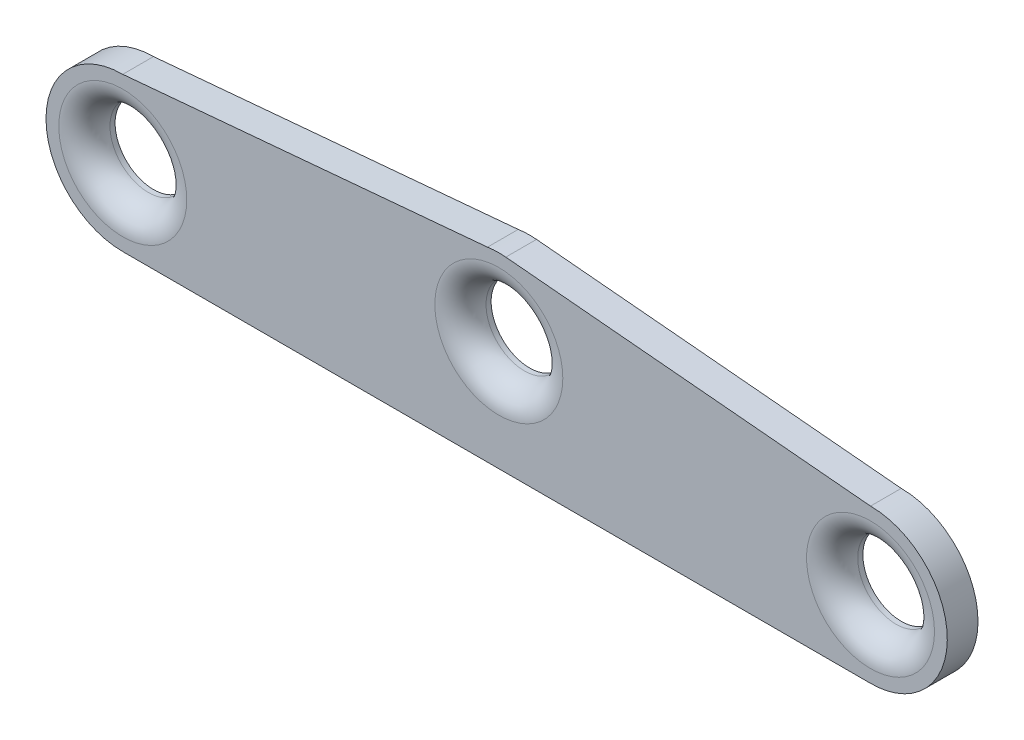
from build123d import *

# Parameters (mm, degrees)
SKETCH_1_R        = 3
SKETCH_1_R_2      = 1.5
EXTRUDE_1_DEPTH   = 1.2
EXTRUDE_1_2_DEPTH = 1.2
EXTRUDE_1_3_DEPTH = 1.2
EXTRUDE_START     = -1.2
EXTRUDE_6_DEPTH   = 1.2
FILLET_1_R        = 1


# Read off the part's stored shape, not the designer's step: Бобышка-Вытянуть6
with BuildPart() as part:
    # Эскиз1 → Бобышка-Вытянуть1 (new body)
    with BuildSketch(Plane.XY):
        with Locations((-14.609483562, -0.654127434)):
            Circle(SKETCH_1_R)
        with Locations((-14.609483562, -0.654127434)):
            Circle(SKETCH_1_R_2, mode=Mode.SUBTRACT)
    extrude(amount=EXTRUDE_1_DEPTH)



with BuildPart() as body_2:
    # Эскиз1 → Extrude 1 2 (new body)
    with BuildSketch(Plane.XY):
        with Locations((0.085103447, 0.656172203)):
            Circle(SKETCH_1_R)
        with Locations((0.085103447, 0.656172203)):
            Circle(SKETCH_1_R_2, mode=Mode.SUBTRACT)
    extrude(amount=EXTRUDE_1_2_DEPTH)


with BuildPart() as body_3:
    # Эскиз1 → Extrude 1 3 (new body)
    with BuildSketch(Plane.XY):
        with Locations((14.609483562, -0.656172203)):
            Circle(SKETCH_1_R)
        with Locations((14.609483562, -0.656172203)):
            Circle(SKETCH_1_R_2, mode=Mode.SUBTRACT)
    extrude(amount=EXTRUDE_1_3_DEPTH)


with BuildPart() as part_1:
    add(part.part)

    add(body_2.part)  # Бобышка-Вытянуть6 merges body 2

    add(body_3.part)  # Бобышка-Вытянуть6 merges body 3
    # Бобышка-Вытянуть6 outline → Бобышка-Вытянуть6 (add)
    with BuildSketch(Plane.XY.offset(1.2).offset(EXTRUDE_START)):
        with BuildLine():
            Line((-0.357791462, 3.62329945), (-14.609483562, 2.345872566))
            ThreePointArc((-14.609483562, 2.345872566), (-11.609512533, -0.640943153), (-14.583115254, -3.65401155))
            Line((-14.583115254, -3.65401155), (14.52155751, -3.654883428))
            ThreePointArc((14.52155751, -3.654883428), (11.609805773, -0.612204455), (14.609483562, 2.343827797))
            Line((14.609483562, 2.343827797), (0.357607149, 3.64377019))
            ThreePointArc((0.357607149, 3.64377019), (0.170911685, -2.34260037), (-0.357791462, 3.62329945))
        make_face()
    extrude(amount=EXTRUDE_6_DEPTH)

    # Скругление1
    fillet_1_edges = [part_1.edges().sort_by_distance(p)[0] for p in [
        (-1.414896553, 0.656172203, 1.2),
        (13.109483562, -0.656172203, 1.2),
        (-16.109483562, -0.654127434, 1.2),
    ]]
    fillet(fillet_1_edges, radius=FILLET_1_R)


solid = part_1.part
